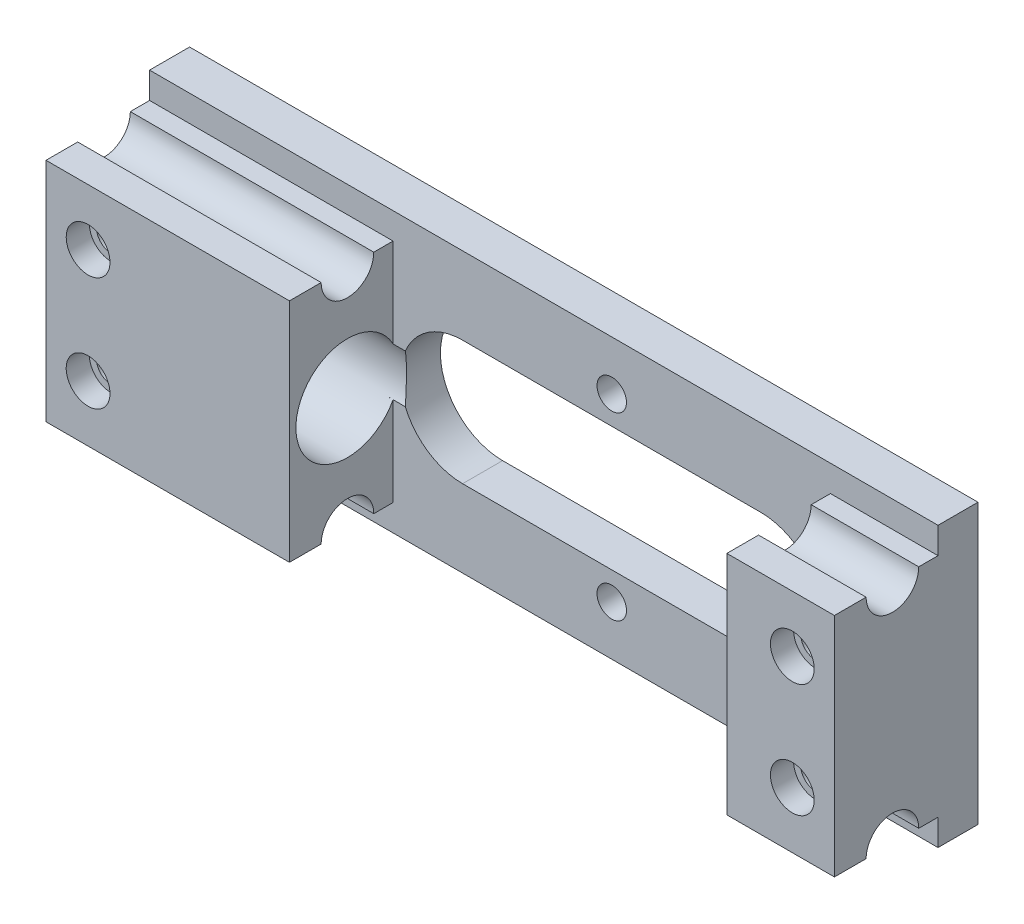
from build123d import *
from build123d.topology import SkipClean

# Parameters (mm, degrees)
SKETCH1_W                       = 44.069
SKETCH1_H                       = 16.8402
BOSS_EXTRUDE1_DEPTH             = 7.1628
SKETCH2_W                       = 26.3906
SKETCH2_H                       = 16.8402
CUT_EXTRUDE1_DEPTH              = 4.75
SKETCH4_W                       = 11.1887
SKETCH4_H                       = 1.5875
SKETCH4_W_2                     = 6.4897
CUT_EXTRUDE9_DEPTH              = 4.75
SKETCH5_R                       = 1.5875
CUT_EXTRUDE10_DEPTH             = 46.43435428
SKETCH14_W                      = 11.1887
SKETCH14_H                      = 13.6652
SKETCH14_W_2                    = 6.4897
BOSS_EXTRUDE3_DEPTH             = 1.5
SKETCH6_R                       = 0.889
CUT_EXTRUDE11_DEPTH             = 26.128895282
SKETCH7_R                       = 1.3208
CUT_EXTRUDE12_DEPTH             = 1.397
SKETCH9_R                       = 0.889
CUT_EXTRUDE13_DEPTH             = 26.128895282
SKETCH10_R                      = 1.190625
CUT_EXTRUDE14_DEPTH             = 1
CUT_EXTRUDE15_DEPTH             = 26.128895282
SKETCH12_R                      = 3.1115
CUT_EXTRUDE16_DEPTH             = 10.922
CUT_EXTRUDE16_DIRECTION_2_REACH = 37.029
BOSS_EXTRUDE4_START             = 3.5
BOSS_EXTRUDE4_DEPTH             = 3.5


with BuildPart() as part:
    # Sketch1 → Boss-Extrude1 (new body)
    with BuildSketch(Plane.XY):
        Rectangle(SKETCH1_W, SKETCH1_H)
    extrude(amount=BOSS_EXTRUDE1_DEPTH)

    # Sketch2 → Cut-Extrude1 (cut)
    with BuildSketch(Plane.XY.offset(7.1628)):
        with Locations((2.3495, 0)):
            Rectangle(SKETCH2_W, SKETCH2_H)
    extrude(amount=-CUT_EXTRUDE1_DEPTH, mode=Mode.SUBTRACT)

    # Sketch4 → Cut-Extrude9 (cut)
    with BuildSketch(Plane.XY.offset(7.1628)):
        with Locations((-16.44015, -7.62635)):
            Rectangle(SKETCH4_W, SKETCH4_H)
        with Locations((-16.44015, 7.62635)):
            Rectangle(SKETCH4_W, SKETCH4_H)
        with Locations((18.78965, -7.62635)):
            Rectangle(SKETCH4_W_2, SKETCH4_H)
        with Locations((18.78965, 7.62635)):
            Rectangle(SKETCH4_W_2, SKETCH4_H)
    extrude(amount=-CUT_EXTRUDE9_DEPTH, mode=Mode.SUBTRACT)

    # Sketch5 → Cut-Extrude10 (cut, through all)
    with BuildSketch(Plane.ZY.offset(22.0345)):
        with Locations((5.1628, -6.8326)):
            Circle(SKETCH5_R)
        with Locations((5.1628, 6.8326)):
            Circle(SKETCH5_R)
    extrude(amount=-CUT_EXTRUDE10_DEPTH, mode=Mode.SUBTRACT)

    # Sketch14 → Boss-Extrude3 (add)
    with BuildSketch(Plane.XY.offset(7.1628)):
        with Locations((-16.44015, 0)):
            Rectangle(SKETCH14_W, SKETCH14_H)
        with Locations((18.78965, 0)):
            Rectangle(SKETCH14_W_2, SKETCH14_H)
    extrude(amount=BOSS_EXTRUDE3_DEPTH)

    # Sketch6 → Cut-Extrude11 (cut, through all)
    with BuildSketch(Plane.XY.offset(8.6628)):
        with Locations((19.4945, 3.429)):
            Circle(SKETCH6_R)
        with Locations((19.4945, -3.429)):
            Circle(SKETCH6_R)
    cut_extrude11 = extrude(amount=-CUT_EXTRUDE11_DEPTH, mode=Mode.SUBTRACT)

    # Sketch7 → Cut-Extrude12 (cut)
    with BuildSketch(Plane.XY.offset(8.6628)):
        with Locations((19.4945, 3.429)):
            Circle(SKETCH7_R)
        with Locations(Location((19.4945, -3.429, 0), (0, 0, 180))):
            Circle(SKETCH7_R)
    cut_extrude12 = extrude(amount=-CUT_EXTRUDE12_DEPTH, mode=Mode.SUBTRACT)

    # Sketch9 → Cut-Extrude13 (cut, through all)
    with BuildSketch(Plane(origin=(0, 0, 0), x_dir=(-1, 0, 0), z_dir=(0, 0, -1))):
        with Locations((-2.3495, 5.4356)):
            Circle(SKETCH9_R)
        with Locations(Location((-2.3495, -5.4356, 0), (0, 0, 180))):
            Circle(SKETCH9_R)
    extrude(amount=-CUT_EXTRUDE13_DEPTH, mode=Mode.SUBTRACT)

    # Sketch10 → Cut-Extrude14 (cut)
    with BuildSketch(Plane(origin=(0, 0, 0), x_dir=(-1, 0, 0), z_dir=(0, 0, -1))):
        with Locations((-2.3495, 5.4356)):
            Circle(SKETCH10_R)
        with Locations(Location((-2.3495, -5.4356, 0), (0, 0, 180))):
            Circle(SKETCH10_R)
    extrude(amount=-CUT_EXTRUDE14_DEPTH, mode=Mode.SUBTRACT)

    # Sketch11 → Cut-Extrude15 (cut, through all)
    with BuildSketch(Plane(origin=(0, 0, 0), x_dir=(-1, 0, 0), z_dir=(0, 0, -1))):
        with BuildLine():
            Line((-11.3495, 3.75), (6.6505, 3.75))
            ThreePointArc((6.6505, 3.75), (10.4005, 0), (6.6505, -3.75))
            Line((6.6505, -3.75), (-11.3495, -3.75))
            ThreePointArc((-11.3495, -3.75), (-15.0995, 0), (-11.3495, 3.75))
        make_face()
    extrude(amount=-CUT_EXTRUDE15_DEPTH, mode=Mode.SUBTRACT)

    # Sketch12 → Cut-Extrude16 (cut)
    with BuildSketch(Plane(origin=(-10.8458, 0, 0), x_dir=(0, 0, -1), z_dir=(1, 0, 0))):
        with Locations(Location((-5.1628, 0, 0), (0, 0, 332.106408593))):
            Circle(SKETCH12_R)
    extrude(amount=-CUT_EXTRUDE16_DEPTH, mode=Mode.SUBTRACT)

    # Sketch12 → Cut-Extrude16 direction 2 (cut, up to next)
    with BuildSketch(Plane(origin=(-10.8458, 0, 0), x_dir=(0, 0, -1), z_dir=(1, 0, 0)), mode=Mode.PRIVATE) as cut_extrude16_direction_2_sk1:
        with Locations(Location((-5.1628, 0, 0), (0, 0, 332.106408593))):
            Circle(SKETCH12_R)
    cut_extrude16_direction_2_tool1 = extrude(cut_extrude16_direction_2_sk1.sketch, amount=CUT_EXTRUDE16_DIRECTION_2_REACH, mode=Mode.PRIVATE) & part.part
    add(cut_extrude16_direction_2_tool1.solids().sort_by_distance((-10.8458, 0, 5.1628))[0], mode=Mode.SUBTRACT)

    # Sketch15 → Boss-Extrude4 (add)
    with SkipClean():  # the faces are left unmerged after this step: merging them gives an invalid solid
        with BuildSketch(Plane.ZY.offset(22.0345).offset(BOSS_EXTRUDE4_START)):
            with BuildLine():
                Line((8.6628, 6.8326), (6.7503, 6.8326))
                ThreePointArc((6.7503, 6.8326), (5.1628, 5.2451), (3.5753, 6.8326))
                Line((3.5753, 6.8326), (2.4128, 6.8326))
                Line((2.4128, 6.8326), (2.4128, 8.4201))
                Line((2.4128, 8.4201), (0, 8.4201))
                Line((0, 8.4201), (0, -8.4201))
                Line((0, -8.4201), (2.4128, -8.4201))
                Line((2.4128, -8.4201), (2.4128, -6.8326))
                Line((2.4128, -6.8326), (3.5753, -6.8326))
                ThreePointArc((3.5753, -6.8326), (5.1628, -5.2451), (6.7503, -6.8326))
                Line((6.7503, -6.8326), (8.6628, -6.8326))
                Line((8.6628, -6.8326), (8.6628, 6.8326))
            make_face()
        extrude(amount=-BOSS_EXTRUDE4_DEPTH)
    add(part.part.scale(1), mode=Mode.REPLACE)  # the faces are merged on a copy

    # Mirror1: Cut-Extrude11, Cut-Extrude12 across plane
    add(cut_extrude11.mirror(Plane(origin=(-1.75, 0, 0), x_dir=(0, 0, 1), z_dir=(1, 0, 0))), mode=Mode.SUBTRACT)
    add(cut_extrude12.mirror(Plane(origin=(-1.75, 0, 0), x_dir=(0, 0, 1), z_dir=(1, 0, 0))), mode=Mode.SUBTRACT)


solid = part.part
